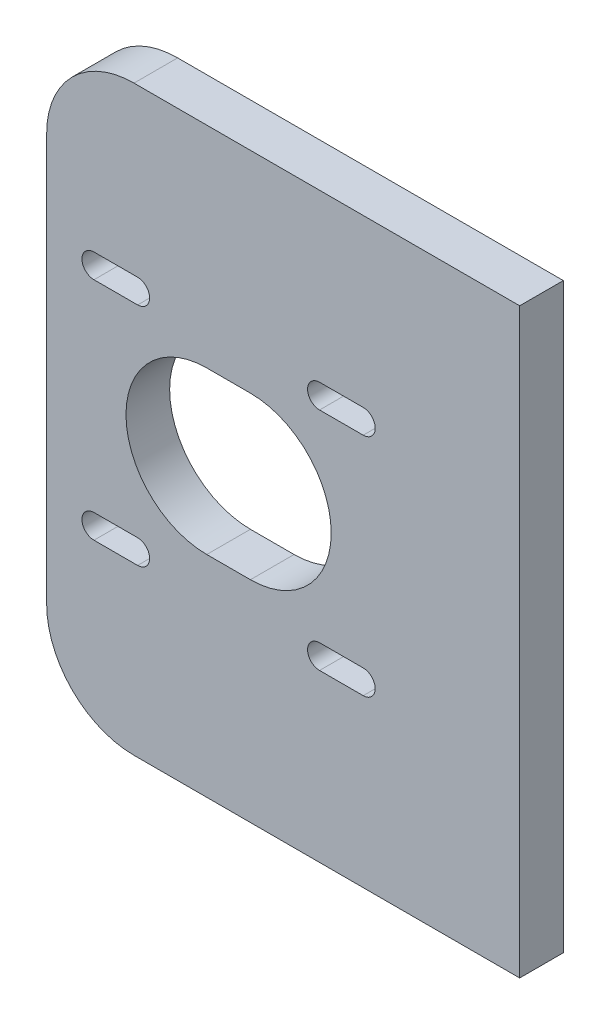
from build123d import *

# Parameters (mm, degrees)
CROQUIS1_W              = 65
CROQUIS1_H              = 80
SALIENTE_EXTRUIR1_DEPTH = 6
CORTAR_EXTRUIR1_DEPTH   = 104.252118622
REDONDEO1_R             = 12


with BuildPart() as part:
    # Croquis1 → Saliente-Extruir1 (new body)
    with BuildSketch(Plane.XY):
        with Locations((32.5, 40)):
            Rectangle(CROQUIS1_W, CROQUIS1_H)
    extrude(amount=SALIENTE_EXTRUIR1_DEPTH)

    # Croquis2 → Cortar-Extruir1 (cut, through all)
    with BuildSketch(Plane(origin=(0, 0, 0), x_dir=(-1, 0, 0), z_dir=(0, 0, -1))):
        with BuildLine():
            Line((-22, 28.9), (-28, 28.9))
            ThreePointArc((-28, 28.9), (-39.1, 40), (-28, 51.1))
            Line((-28, 51.1), (-22, 51.1))
            ThreePointArc((-22, 51.1), (-10.9, 40), (-22, 28.9))
        make_face()
        with BuildLine():
            Line((-6.5, 22.85), (-12.5, 22.85))
            ThreePointArc((-12.5, 22.85), (-14.15, 24.5), (-12.5, 26.15))
            Line((-12.5, 26.15), (-6.5, 26.15))
            ThreePointArc((-6.5, 26.15), (-4.85, 24.5), (-6.5, 22.85))
        make_face()
        with BuildLine():
            Line((-37.5, 53.85), (-43.5, 53.85))
            ThreePointArc((-43.5, 53.85), (-45.15, 55.5), (-43.5, 57.15))
            Line((-43.5, 57.15), (-37.5, 57.15))
            ThreePointArc((-37.5, 57.15), (-35.85, 55.5), (-37.5, 53.85))
        make_face()
        with BuildLine():
            Line((-37.5, 22.85), (-43.5, 22.85))
            ThreePointArc((-43.5, 22.85), (-45.15, 24.5), (-43.5, 26.15))
            Line((-43.5, 26.15), (-37.5, 26.15))
            ThreePointArc((-37.5, 26.15), (-35.85, 24.5), (-37.5, 22.85))
        make_face()
        with BuildLine():
            Line((-6.5, 53.85), (-12.5, 53.85))
            ThreePointArc((-12.5, 53.85), (-14.15, 55.5), (-12.5, 57.15))
            Line((-12.5, 57.15), (-6.5, 57.15))
            ThreePointArc((-6.5, 57.15), (-4.85, 55.5), (-6.5, 53.85))
        make_face()
    extrude(amount=-CORTAR_EXTRUIR1_DEPTH, mode=Mode.SUBTRACT)

    # Redondeo1
    redondeo1_edges = [part.edges().sort_by_distance(p)[0] for p in [
        (0, 0, 3),
        (0, 80, 3),
    ]]
    fillet(redondeo1_edges, radius=REDONDEO1_R)


solid = part.part
